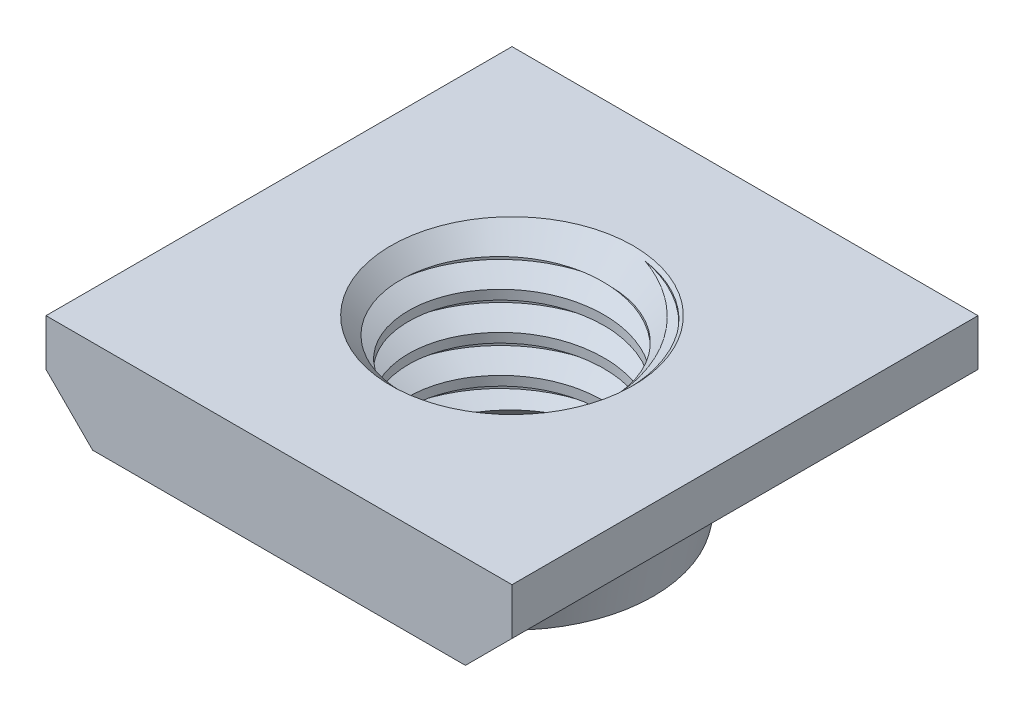
from build123d import *

# Parameters (mm, degrees)
BOSS_EXTRUDE1_DEPTH = 5
SKETCH2_R           = 2.1
CUT_EXTRUDE1_DEPTH  = 8.348469228
CHAMFER1_SIZE       = 0.5
THREAD1_PITCH       = 0.8


with BuildPart() as part:
    # Sketch1 → Boss-Extrude1 (new, symmetric)
    with BuildSketch(Plane.XY):
        Polygon((-5, 1), (5, 1), (5, 0), (4, -1), (-4, -1), (-5, 0), align=None)
    extrude(amount=BOSS_EXTRUDE1_DEPTH, both=True)

    # Sketch2 → Cut-Extrude1 (cut, through all)
    with BuildSketch(Plane(origin=(0, 1, 0), x_dir=(1, 0, 0), z_dir=(0, 1, 0))):
        with Locations(Location((0, 0, 0), (0, 0, 270))):
            Circle(SKETCH2_R)
    extrude(amount=-CUT_EXTRUDE1_DEPTH, mode=Mode.SUBTRACT)

    # Sketch3 → Revolve1 (revolve)
    with BuildSketch(Plane(origin=(0, 0, 0), x_dir=(0, 0, -1), z_dir=(1, 0, 0)), mode=Mode.PRIVATE) as revolve1_sk:
        Polygon((2.1, -1), (2.1, -2.7), (3.033, -2.7), (3.382887608, -1), align=None)
    revolve(revolve1_sk.sketch.rotate(Axis((0, 1, 0), (0, -1, 0)), 180), axis=Axis((0, 1, 0), (0, -1, 0)))

    # Chamfer1
    chamfer1_edges = [part.edges().sort_by_distance(p)[0] for p in [
        (0, 1, -2.1),
        (0, -2.7, -2.1),
    ]]
    chamfer(chamfer1_edges, length=CHAMFER1_SIZE)

    # Thread1: the profile of Thread Profile1 profile screwed along a right-hand helix of 6.25 turns, 8 arcs to a turn; built about Z, then put on its axis
    thread1_z = Axis((0, 0, 0), (0, 0, 1))
    thread1_corners = [(2.0997, 0, -0.000173205), (2.5330127, 0, 0.249999999), (2.5330127, 0, 0.349999999), (2.0997, 0, 0.600173203)]
    with BuildLine(mode=Mode.PRIVATE) as thread1_profile:
        Line(thread1_corners[0], thread1_corners[1])
        Line(thread1_corners[1], thread1_corners[2])
        Line(thread1_corners[2], thread1_corners[3])
        Line(thread1_corners[3], thread1_corners[0])
    thread1_cap = Face(thread1_profile.wire())
    thread1_turn_angles = [0, 22.5, 45, 67.5, 90, 112.5, 135, 157.5, 180, 202.5, 225, 247.5, 270, 292.5, 315, 337.5, 360]
    thread1_turn_weights = [1, 0.9238795325112867, 1, 0.9238795325112867, 1, 0.9238795325112867, 1, 0.9238795325112867, 1, 0.9238795325112867, 1, 0.9238795325112867, 1, 0.9238795325112867, 1, 0.9238795325112867, 1]
    thread1_turn_rails = [Edge.make_bspline([Vector(p[0], p[1], 0).rotate(thread1_z, thread1_turn_angles[k]) / thread1_turn_weights[k] + Vector(0, 0, p[2] + THREAD1_PITCH * thread1_turn_angles[k] / 360) for k in range(17)], [0, 0, 0, 1, 1, 2, 2, 3, 3, 4, 4, 5, 5, 6, 6, 7, 7, 8, 8, 8], 2, thread1_turn_weights) for p in thread1_corners]
    thread1_turn_sides = [Face.make_surface_from_curves(thread1_turn_rails[p[0]], thread1_turn_rails[p[1]]) for p in [(0, 1), (1, 2), (2, 3), (3, 0)]]
    thread1_last_angles = [2160, 2182.5, 2205, 2227.5, 2250]
    thread1_last_weights = [1, 0.9238795325112867, 1, 0.9238795325112867, 1]
    thread1_last_rails = [Edge.make_bspline([Vector(p[0], p[1], 0).rotate(thread1_z, thread1_last_angles[k]) / thread1_last_weights[k] + Vector(0, 0, p[2] + THREAD1_PITCH * thread1_last_angles[k] / 360) for k in range(5)], [0, 0, 0, 1, 1, 2, 2, 2], 2, thread1_last_weights) for p in thread1_corners]
    thread1_last_sides = [Face.make_surface_from_curves(thread1_last_rails[p[0]], thread1_last_rails[p[1]]) for p in [(0, 1), (1, 2), (2, 3), (3, 0)]]
    thread1 = Plane(origin=(0, 1.5, 0), x_dir=(-1, 0, 0), z_dir=(0, -1, 0)) * Solid(Shell([*[p.moved(Location((0, 0, THREAD1_PITCH * i))) for i in range(6) for p in thread1_turn_sides], *thread1_last_sides, thread1_cap, thread1_cap.rotate(thread1_z, 2250).moved(Location((0, 0, THREAD1_PITCH * 2250 / 360)))]))
    add(thread1, mode=Mode.SUBTRACT)


solid = part.part
